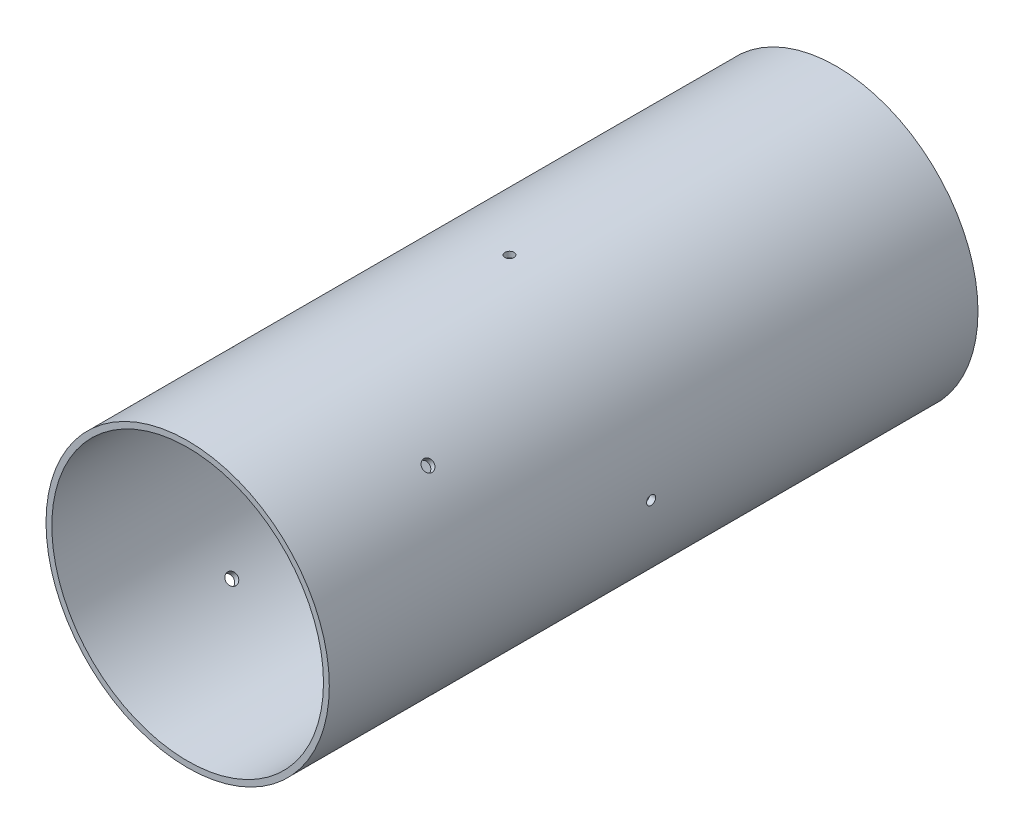
from build123d import *

# Parameters (mm, degrees)
SKETCH1_R           = 49.53
SKETCH1_R_2         = 47.498
BOSS_EXTRUDE1_DEPTH = 226.822
SKETCH2_R           = 1.984375
CUT_EXTRUDE1_DEPTH  = 12.7
CIRPATTERN1_COUNT   = 4
SKETCH3_R           = 2.38125
CUT_EXTRUDE2_DEPTH  = 25.4
SKETCH4_R           = 1.5875
CUT_EXTRUDE3_DEPTH  = 37.338
CIRPATTERN2_COUNT   = 4
SKETCH5_R           = 1.0922
CUT_EXTRUDE4_DEPTH  = 25.4
CIRPATTERN3_COUNT   = 2


with BuildPart() as part:
    # Sketch1 → Boss-Extrude1 (new body)
    with BuildSketch(Plane.XY):
        Circle(SKETCH1_R)
        Circle(SKETCH1_R_2, mode=Mode.SUBTRACT)
    extrude(amount=BOSS_EXTRUDE1_DEPTH)

    # Sketch2 → Cut-Extrude1 (cut)
    with BuildSketch(Plane(origin=(-120.58027232, -48.738223352, -78.995371644), x_dir=(0.7071067811865487, 0.7071067811865465, 0), z_dir=(-0.7071067811865465, 0.7071067811865487, 0))):
        with Locations((119.72625647, -256.795371644)):
            Circle(SKETCH2_R)
    cut_extrude1 = extrude(amount=-CUT_EXTRUDE1_DEPTH, mode=Mode.SUBTRACT)

    # CirPattern1: Cut-Extrude1 ×4 about axis
    cirpattern1_axis = Axis((0, 0, 0), (0, 0, -1))
    for i in range(1, CIRPATTERN1_COUNT):
        add(cut_extrude1.rotate(cirpattern1_axis, i * 360 / CIRPATTERN1_COUNT), mode=Mode.SUBTRACT)

    # Sketch3 → Cut-Extrude2 (cut)
    with BuildSketch(Plane(origin=(-108.021767186, -85.49918909, -79.333156205), x_dir=(0, 0, 1), z_dir=(-0.8660254037844379, 0.5000000000000014, 0))):
        with Locations((196.808156205, 128.055353348)):
            Circle(SKETCH3_R)
        with Locations((190.458156205, 128.055353348)):
            Circle(SKETCH3_R)
    extrude(amount=-CUT_EXTRUDE2_DEPTH, mode=Mode.SUBTRACT)

    # Sketch4 → Cut-Extrude3 (cut)
    with BuildSketch(Plane(origin=(-33.663219436, -130.56478129, -80.778194099), x_dir=(0, 0, -1), z_dir=(1, 0, 0))):
        with Locations((-195.078194099, 130.56478129)):
            Circle(SKETCH4_R)
    cut_extrude3 = extrude(amount=-CUT_EXTRUDE3_DEPTH, mode=Mode.SUBTRACT)

    # CirPattern2: Cut-Extrude3 ×4 about axis
    cirpattern2_axis = Axis((0, 0, 226.822), (0, 0, -1))
    for i in range(1, CIRPATTERN2_COUNT):
        add(cut_extrude3.rotate(cirpattern2_axis, i * 360 / CIRPATTERN2_COUNT), mode=Mode.SUBTRACT)

    # Sketch5 → Cut-Extrude4 (cut)
    with BuildSketch(Plane(origin=(-120.58027232, -48.738223352, -78.995371644), x_dir=(0.7071067811865487, 0.7071067811865465, 0), z_dir=(-0.7071067811865465, 0.7071067811865487, 0))):
        with Locations((119.72625647, -129.795371644)):
            Circle(SKETCH5_R)
    cut_extrude4 = extrude(amount=-CUT_EXTRUDE4_DEPTH, mode=Mode.SUBTRACT)

    # CirPattern3: Cut-Extrude4 ×2 about axis
    cirpattern3_axis = Axis((0, 0, 0), (0, 0, -1))
    for i in range(1, CIRPATTERN3_COUNT):
        add(cut_extrude4.rotate(cirpattern3_axis, i * 360 / CIRPATTERN3_COUNT), mode=Mode.SUBTRACT)


solid = part.part
